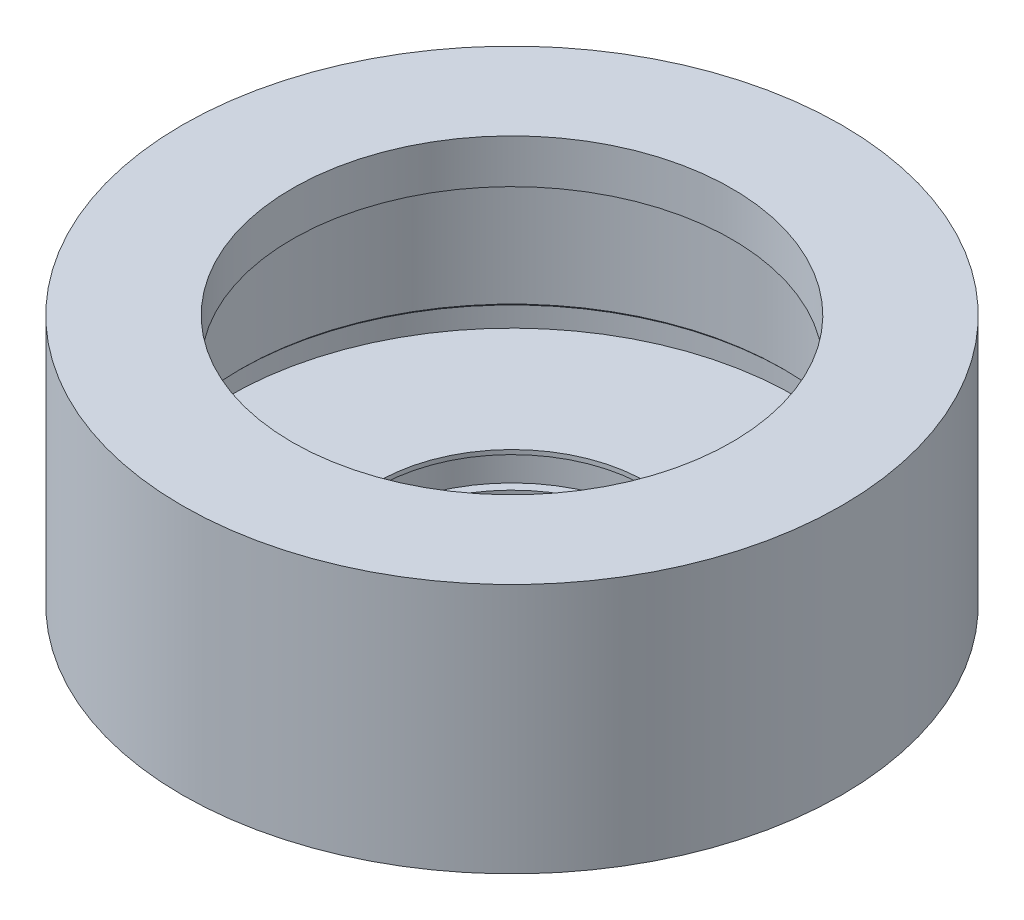
from build123d import *

# Parameters (mm, degrees)
SKETCH1_R                 = 75
SKETCH1_R_2               = 61.6875
GEAR_BOSS_DEPTH           = 12.5
TOOTH_CORNER_CHAMFER_SIZE = 0.6


with BuildPart() as part:
    # Sketch1 → Gear Boss (new, symmetric)
    with BuildSketch(Plane(origin=(0, 0, 0), x_dir=(1, 0, 0), z_dir=(0, 1, 0))):
        Circle(SKETCH1_R)
        Circle(SKETCH1_R_2, mode=Mode.SUBTRACT)
    extrude(amount=GEAR_BOSS_DEPTH, both=True)

    # Tooth Corner Chamfer
    tooth_corner_chamfer_edges = [part.edges().sort_by_distance(p)[0] for p in [
        (-61.6875, -12.5, 0),
        (-61.6875, 12.5, 0),
    ]]
    chamfer(tooth_corner_chamfer_edges, length=TOOTH_CORNER_CHAMFER_SIZE)

    # Sketch8 → Revolve1 (revolve)
    with BuildSketch(Plane(origin=(0, 0, 0), x_dir=(0, 0, -1), z_dir=(1, 0, 0))):
        Polygon((30.5, -18.5), (64.3125, -18.5), (64.3125, -12.5), (75, -12.5), (75, -27.5), (30.5, -27.5), (30.5, -26.5), (32.5, -26.5), (32.5, -19.5), (30.5, -19.5), align=None)
        Polygon((50, 29.5), (75, 29.5), (75, 12.5), (64.3125, 12.5), (64.3125, 19.5), (50, 19.5), align=None)
    revolve(axis=Axis((0, 19.75, 0), (0, -1, 0)))


solid = part.part
